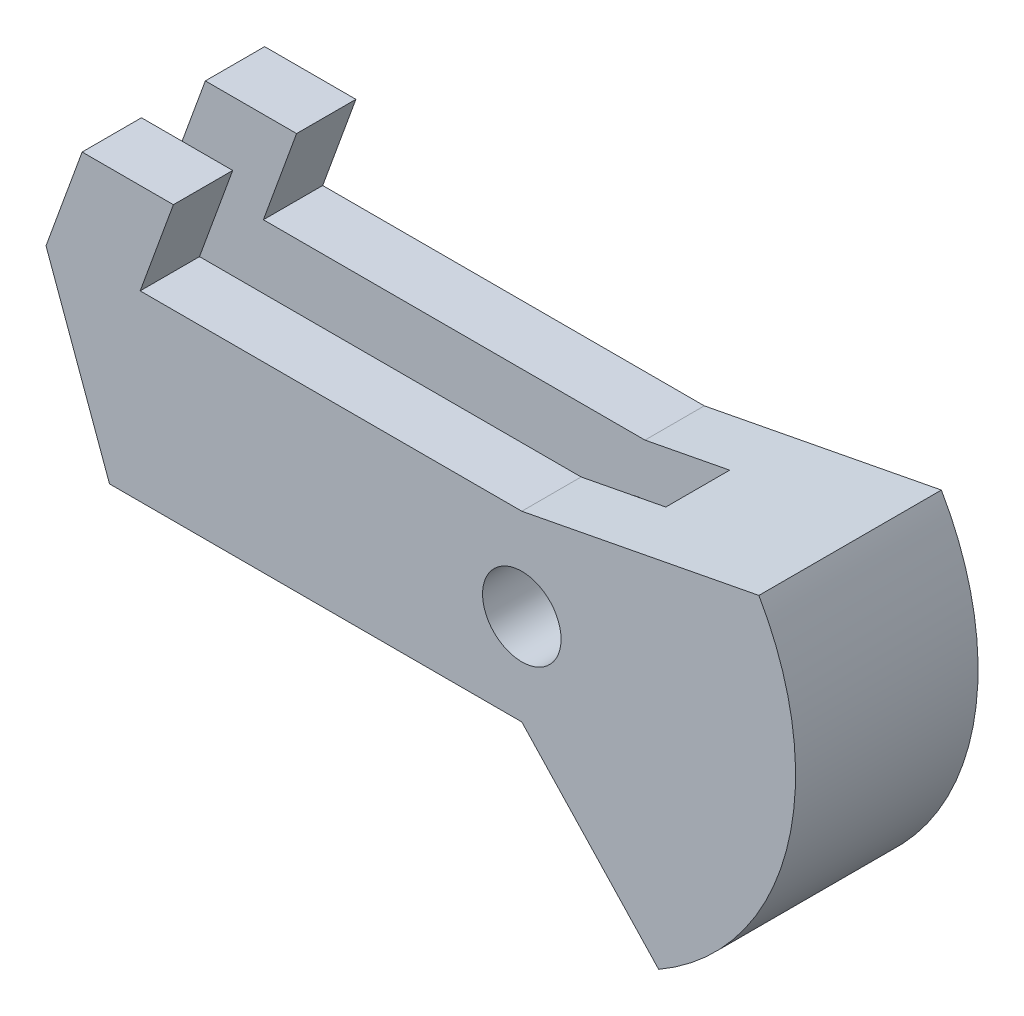
from build123d import *

# Parameters (mm, degrees)
BOSS_EXTRUDE2_DEPTH  = 5
CUT_EXTRUDE1_DEPTH   = 1.75
M4_CLEARANCE_HOLE1_D = 4.3


with BuildPart() as part:
    # Sketch5 → Boss-Extrude2 (new, symmetric)
    with BuildSketch(Plane.XY):
        with BuildLine():
            Line((12.990381057, 7.5), (0, 5))
            Line((0, 5), (-20.909925586, 5))
            Line((-20.909925586, 5), (-19.090074414, 10))
            Line((-19.090074414, 10), (-24.090074414, 10))
            Line((-24.090074414, 10), (-26.070370017, 4.559182548))
            Line((-26.070370017, 4.559182548), (-22.591112105, -5))
            Line((-22.591112105, -5), (0, -5))
            Line((0, -5), (7.5, -12.990381057))
            ThreePointArc((7.5, -12.990381057), (14.488887394, -3.882285677), (12.990381057, 7.5))
        make_face()
    extrude(amount=BOSS_EXTRUDE2_DEPTH, both=True)

    # Sketch6 → Cut-Extrude1 (cut, symmetric)
    with BuildSketch(Plane.XY):
        with BuildLine():
            Line((-19.090074414, 10), (-20.909925586, 5))
            Line((-20.909925586, 5), (0, 5))
            Line((0, 5), (4.639421806, 5.892857143))
            ThreePointArc((4.639421806, 5.892857143), (7.360047757, -1.442115466), (2.072466945, -7.207973416))
            Line((2.072466945, -7.207973416), (0, -5))
            Line((0, -5), (-22.591112105, -5))
            Line((-22.591112105, -5), (-26.070370017, 4.559182548))
            Line((-26.070370017, 4.559182548), (-24.090074414, 10))
            Line((-24.090074414, 10), (-19.090074414, 10))
        make_face()
    extrude(amount=CUT_EXTRUDE1_DEPTH, both=True, mode=Mode.SUBTRACT)

    # M4 Clearance Hole1 (through all)
    with Locations(Plane.XY.offset(5)):
        with Locations((0, 0)):
            Hole(M4_CLEARANCE_HOLE1_D / 2)


solid = part.part
